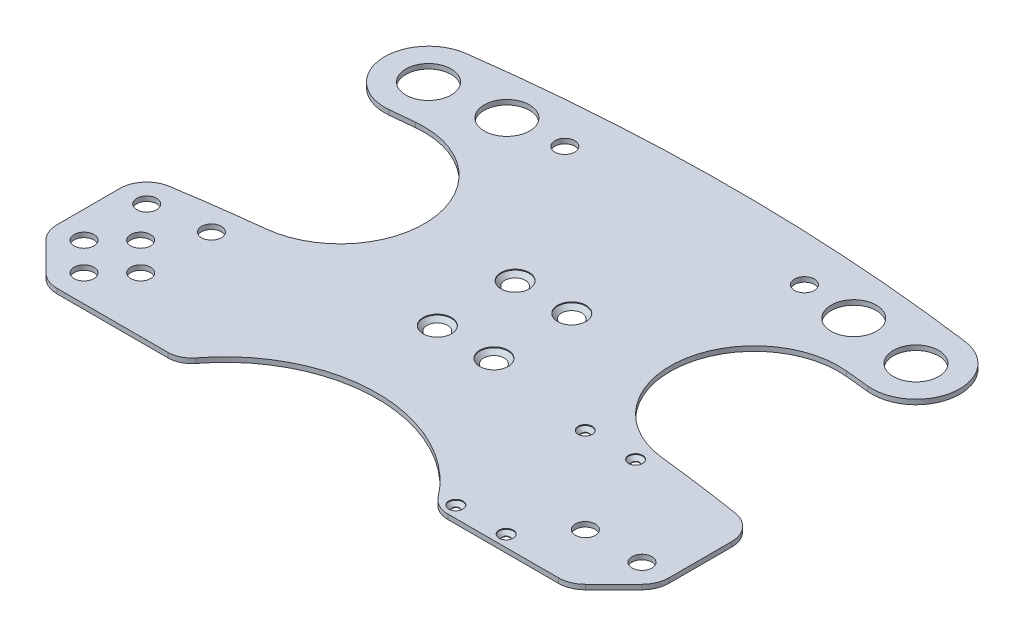
from build123d import *

# Parameters (mm, degrees)
SKETCH1_R                                      = 2.5
BOSS_EXTRUDE1_DEPTH                            = 1.7
CUT_EXTRUDE1_REACH                             = 155.062
SKETCH2_R                                      = 3.5
SKETCH2_R_2                                    = 8
CUT_EXTRUDE2_REACH                             = 155.062
SKETCH3_R                                      = 1.3
CSK_FOR_M5_FLAT_HEAD_MACHINE_SCREW1_AT_2_COUNT = 2
CSK_FOR_M5_FLAT_HEAD_MACHINE_SCREW1_AT_2_PITCH = 20
CSK_FOR_M5_FLAT_HEAD_MACHINE_SCREW1_AT_3_COUNT = 2
CSK_FOR_M5_FLAT_HEAD_MACHINE_SCREW1_AT_3_PITCH = 34.003676272
CSK_FOR_M5_FLAT_HEAD_MACHINE_SCREW1_AT_4_COUNT = 2
CSK_FOR_M5_FLAT_HEAD_MACHINE_SCREW1_AT_4_PITCH = 27.5
CSK_FOR_M2_5_FLAT_HEAD_MACHINE_SCREW1_AT_COUNT = 2
CSK_FOR_M2_5_FLAT_HEAD_MACHINE_SCREW1_AT_PITCH = 17.78
CSK_FOR_M2_5_FLAT_HEAD_MACHINE_SCREW_2_COUNT   = 2
CSK_FOR_M2_5_FLAT_HEAD_MACHINE_SCREW_2_PITCH   = 49.055548106
CSK_FOR_M2_5_FLAT_HEAD_MACHINE_SCREW_3_COUNT   = 2
CSK_FOR_M2_5_FLAT_HEAD_MACHINE_SCREW_3_PITCH   = 45.72
FILLET1_R                                      = 8.5


with BuildPart() as part:
    # Sketch1 → Boss-Extrude1 (new body)
    with BuildSketch(Plane(origin=(0, 0, 0), x_dir=(1, 0, 0), z_dir=(0, 1, 0))):
        with BuildLine():
            Line((-73.314391493, -95), (73.314391493, -95))
            ThreePointArc((73.314391493, -95), (120, 0), (73.314391493, 95))
            Line((73.314391493, 95), (-73.314391493, 95))
            ThreePointArc((-73.314391493, 95), (-120, 0), (-73.314391493, -95))
        make_face()
        with Locations((-10, 13.75)):
            Circle(SKETCH1_R, mode=Mode.SUBTRACT)
        with Locations((-10, -13.75)):
            Circle(SKETCH1_R, mode=Mode.SUBTRACT)
        with Locations((10, -13.75)):
            Circle(SKETCH1_R, mode=Mode.SUBTRACT)
        with Locations((10, 13.75)):
            Circle(SKETCH1_R, mode=Mode.SUBTRACT)
    extrude(amount=BOSS_EXTRUDE1_DEPTH)

    # Sketch2 → Cut-Extrude1 (cut, up to next)
    with BuildSketch(Plane(origin=(0, 1.7, 0), x_dir=(1, 0, 0), z_dir=(0, 1, 0)), mode=Mode.PRIVATE) as cut_extrude1_sk1:
        with Locations((-88.540600769, -40)):
            Circle(SKETCH2_R)
    cut_extrude1_tool1 = extrude(cut_extrude1_sk1.sketch, amount=-CUT_EXTRUDE1_REACH, mode=Mode.PRIVATE) & part.part
    # Sketch2 → Cut-Extrude1 (cut, up to next)
    with BuildSketch(Plane(origin=(0, 1.7, 0), x_dir=(1, 0, 0), z_dir=(0, 1, 0)), mode=Mode.PRIVATE) as cut_extrude1_sk2:
        with Locations((-78.540600769, -50)):
            Circle(SKETCH2_R)
    cut_extrude1_tool2 = extrude(cut_extrude1_sk2.sketch, amount=-CUT_EXTRUDE1_REACH, mode=Mode.PRIVATE) & part.part
    # Sketch2 → Cut-Extrude1 (cut, up to next)
    with BuildSketch(Plane(origin=(0, 1.7, 0), x_dir=(1, 0, 0), z_dir=(0, 1, 0)), mode=Mode.PRIVATE) as cut_extrude1_sk3:
        with Locations((-88.540600769, -60)):
            Circle(SKETCH2_R)
    cut_extrude1_tool3 = extrude(cut_extrude1_sk3.sketch, amount=-CUT_EXTRUDE1_REACH, mode=Mode.PRIVATE) & part.part
    # Sketch2 → Cut-Extrude1 (cut, up to next)
    with BuildSketch(Plane(origin=(0, 1.7, 0), x_dir=(1, 0, 0), z_dir=(0, 1, 0)), mode=Mode.PRIVATE) as cut_extrude1_sk4:
        with Locations((-98.540600769, -50)):
            Circle(SKETCH2_R)
    cut_extrude1_tool4 = extrude(cut_extrude1_sk4.sketch, amount=-CUT_EXTRUDE1_REACH, mode=Mode.PRIVATE) & part.part
    # Sketch2 → Cut-Extrude1 (cut, up to next)
    with BuildSketch(Plane(origin=(0, 1.7, 0), x_dir=(1, 0, 0), z_dir=(0, 1, 0)), mode=Mode.PRIVATE) as cut_extrude1_sk5:
        with Locations((78.540600769, -50)):
            Circle(SKETCH2_R)
    cut_extrude1_tool5 = extrude(cut_extrude1_sk5.sketch, amount=-CUT_EXTRUDE1_REACH, mode=Mode.PRIVATE) & part.part
    # Sketch2 → Cut-Extrude1 (cut, up to next)
    with BuildSketch(Plane(origin=(0, 1.7, 0), x_dir=(1, 0, 0), z_dir=(0, 1, 0)), mode=Mode.PRIVATE) as cut_extrude1_sk6:
        with Locations((98.540600769, -50)):
            Circle(SKETCH2_R)
    cut_extrude1_tool6 = extrude(cut_extrude1_sk6.sketch, amount=-CUT_EXTRUDE1_REACH, mode=Mode.PRIVATE) & part.part
    # Sketch2 → Cut-Extrude1 (cut, up to next)
    with BuildSketch(Plane(origin=(0, 1.7, 0), x_dir=(1, 0, 0), z_dir=(0, 1, 0)), mode=Mode.PRIVATE) as cut_extrude1_sk7:
        with Locations((-98.540600769, -27.862546721)):
            Circle(SKETCH2_R)
    cut_extrude1_tool7 = extrude(cut_extrude1_sk7.sketch, amount=-CUT_EXTRUDE1_REACH, mode=Mode.PRIVATE) & part.part
    # Sketch2 → Cut-Extrude1 (cut, up to next)
    with BuildSketch(Plane(origin=(0, 1.7, 0), x_dir=(1, 0, 0), z_dir=(0, 1, 0)), mode=Mode.PRIVATE) as cut_extrude1_sk8:
        with Locations((-78.540600769, -25)):
            Circle(SKETCH2_R)
    cut_extrude1_tool8 = extrude(cut_extrude1_sk8.sketch, amount=-CUT_EXTRUDE1_REACH, mode=Mode.PRIVATE) & part.part
    # Sketch2 → Cut-Extrude1 (cut, up to next)
    with BuildSketch(Plane(origin=(0, 1.7, 0), x_dir=(1, 0, 0), z_dir=(0, 1, 0)), mode=Mode.PRIVATE) as cut_extrude1_sk9:
        with Locations((-86.094520408, 59.228232759)):
            Circle(SKETCH2_R_2)
    cut_extrude1_tool9 = extrude(cut_extrude1_sk9.sketch, amount=-CUT_EXTRUDE1_REACH, mode=Mode.PRIVATE) & part.part
    # Sketch2 → Cut-Extrude1 (cut, up to next)
    with BuildSketch(Plane(origin=(0, 1.7, 0), x_dir=(1, 0, 0), z_dir=(0, 1, 0)), mode=Mode.PRIVATE) as cut_extrude1_sk10:
        with Locations((-61.259580586, 62.084312054)):
            Circle(SKETCH2_R_2)
    cut_extrude1_tool10 = extrude(cut_extrude1_sk10.sketch, amount=-CUT_EXTRUDE1_REACH, mode=Mode.PRIVATE) & part.part
    # Sketch2 → Cut-Extrude1 (cut, up to next)
    with BuildSketch(Plane(origin=(0, 1.7, 0), x_dir=(1, 0, 0), z_dir=(0, 1, 0)), mode=Mode.PRIVATE) as cut_extrude1_sk11:
        with Locations((61.259580586, 62.084312054)):
            Circle(SKETCH2_R_2)
    cut_extrude1_tool11 = extrude(cut_extrude1_sk11.sketch, amount=-CUT_EXTRUDE1_REACH, mode=Mode.PRIVATE) & part.part
    # Sketch2 → Cut-Extrude1 (cut, up to next)
    with BuildSketch(Plane(origin=(0, 1.7, 0), x_dir=(1, 0, 0), z_dir=(0, 1, 0)), mode=Mode.PRIVATE) as cut_extrude1_sk12:
        with Locations((86.094520408, 59.228232759)):
            Circle(SKETCH2_R_2)
    cut_extrude1_tool12 = extrude(cut_extrude1_sk12.sketch, amount=-CUT_EXTRUDE1_REACH, mode=Mode.PRIVATE) & part.part
    # Sketch2 → Cut-Extrude1 (cut, up to next)
    with BuildSketch(Plane(origin=(0, 1.7, 0), x_dir=(1, 0, 0), z_dir=(0, 1, 0)), mode=Mode.PRIVATE) as cut_extrude1_sk13:
        with Locations((-42.320942156, 63.610082158)):
            Circle(SKETCH2_R)
    cut_extrude1_tool13 = extrude(cut_extrude1_sk13.sketch, amount=-CUT_EXTRUDE1_REACH, mode=Mode.PRIVATE) & part.part
    # Sketch2 → Cut-Extrude1 (cut, up to next)
    with BuildSketch(Plane(origin=(0, 1.7, 0), x_dir=(1, 0, 0), z_dir=(0, 1, 0)), mode=Mode.PRIVATE) as cut_extrude1_sk14:
        with Locations((42.320942156, 63.610082158)):
            Circle(SKETCH2_R)
    cut_extrude1_tool14 = extrude(cut_extrude1_sk14.sketch, amount=-CUT_EXTRUDE1_REACH, mode=Mode.PRIVATE) & part.part
    add(cut_extrude1_tool1.solids().sort_by_distance((-88.540601, 1.7, 40))[0], mode=Mode.SUBTRACT)
    add(cut_extrude1_tool2.solids().sort_by_distance((-78.540601, 1.7, 50))[0], mode=Mode.SUBTRACT)
    add(cut_extrude1_tool3.solids().sort_by_distance((-88.540601, 1.7, 60))[0], mode=Mode.SUBTRACT)
    add(cut_extrude1_tool4.solids().sort_by_distance((-98.540601, 1.7, 50))[0], mode=Mode.SUBTRACT)
    add(cut_extrude1_tool5.solids().sort_by_distance((78.540601, 1.7, 50))[0], mode=Mode.SUBTRACT)
    add(cut_extrude1_tool6.solids().sort_by_distance((98.540601, 1.7, 50))[0], mode=Mode.SUBTRACT)
    add(cut_extrude1_tool7.solids().sort_by_distance((-98.540601, 1.7, 27.862547))[0], mode=Mode.SUBTRACT)
    add(cut_extrude1_tool8.solids().sort_by_distance((-78.540601, 1.7, 25))[0], mode=Mode.SUBTRACT)
    add(cut_extrude1_tool9.solids().sort_by_distance((-86.09452, 1.7, -59.228233))[0], mode=Mode.SUBTRACT)
    add(cut_extrude1_tool10.solids().sort_by_distance((-61.259581, 1.7, -62.084312))[0], mode=Mode.SUBTRACT)
    add(cut_extrude1_tool11.solids().sort_by_distance((61.259581, 1.7, -62.084312))[0], mode=Mode.SUBTRACT)
    add(cut_extrude1_tool12.solids().sort_by_distance((86.09452, 1.7, -59.228233))[0], mode=Mode.SUBTRACT)
    add(cut_extrude1_tool13.solids().sort_by_distance((-42.320942, 1.7, -63.610082))[0], mode=Mode.SUBTRACT)
    add(cut_extrude1_tool14.solids().sort_by_distance((42.320942, 1.7, -63.610082))[0], mode=Mode.SUBTRACT)

    # Sketch3 → Cut-Extrude2 (cut, up to next)
    with BuildSketch(Plane(origin=(0, 1.7, 0), x_dir=(1, 0, 0), z_dir=(0, 1, 0)), mode=Mode.PRIVATE) as cut_extrude2_sk1:
        with BuildLine():
            Line((-76.105925997, 44.650651574), (-84.550645906, 43.805313077))
            ThreePointArc((-84.550645906, 43.805313077), (-99.436668511, 51.3391844), (-98.864520746, 68.013282068))
            ThreePointArc((-98.864520746, 68.013282068), (-119.734623685, 7.97620781), (-107.012417284, -54.298642221))
            ThreePointArc((-107.012417284, -54.298642221), (-107.779979993, -52.209948315), (-108.040600769, -50))
            Line((-108.040600769, -50), (-108.040600769, -27.862546721))
            ThreePointArc((-108.040600769, -27.862546721), (-105.768300058, -21.697292226), (-100.038419088, -18.48136661))
            ThreePointArc((-100.038419088, -18.48136661), (-84.982869082, -16.262381048), (-69.878431955, -14.405108328))
            ThreePointArc((-69.878431955, -14.405108328), (-43.620166463, 18.220082253), (-76.105925997, 44.650651574))
        make_face()
    cut_extrude2_tool1 = extrude(cut_extrude2_sk1.sketch, amount=-CUT_EXTRUDE2_REACH, mode=Mode.PRIVATE) & part.part
    # Sketch3 → Cut-Extrude2 (cut, up to next)
    with BuildSketch(Plane(origin=(0, 1.7, 0), x_dir=(1, 0, 0), z_dir=(0, 1, 0)), mode=Mode.PRIVATE) as cut_extrude2_sk2:
        with BuildLine():
            ThreePointArc((-98.864520746, 68.013282068), (-94.209950954, 72.433905292), (-88.163447862, 74.589532807))
            ThreePointArc((-88.163447862, 74.589532807), (1.3e-08, 80.5), (88.163447888, 74.589532804))
            ThreePointArc((88.163447888, 74.589532804), (94.209951277, 72.433905093), (98.864521161, 68.013281465))
            ThreePointArc((98.864521161, 68.013281465), (87.140491363, 82.50172583), (73.314391493, 95))
            Line((73.314391493, 95), (-73.314391493, 95))
            ThreePointArc((-73.314391493, 95), (-87.140491112, 82.501726096), (-98.864520746, 68.013282068))
        make_face()
    cut_extrude2_tool2 = extrude(cut_extrude2_sk2.sketch, amount=-CUT_EXTRUDE2_REACH, mode=Mode.PRIVATE) & part.part
    # Sketch3 → Cut-Extrude2 (cut, up to next)
    with BuildSketch(Plane(origin=(0, 1.7, 0), x_dir=(1, 0, 0), z_dir=(0, 1, 0)), mode=Mode.PRIVATE) as cut_extrude2_sk3:
        with BuildLine():
            ThreePointArc((-105.258115191, -56.717514421), (-106.230963521, -55.577483371), (-107.012417284, -54.298642221))
            ThreePointArc((-107.012417284, -54.298642221), (-92.431540192, -76.527187181), (-73.314391493, -95))
            Line((-73.314391493, -95), (73.314391493, -95))
            ThreePointArc((73.314391493, -95), (92.431540082, -76.527187314), (107.012417128, -54.298642528))
            ThreePointArc((107.012417128, -54.298642528), (106.23096342, -55.57748351), (105.258115191, -56.717514421))
            Line((105.258115191, -56.717514421), (95.258115191, -66.717514421))
            ThreePointArc((95.258115191, -66.717514421), (92.176093377, -68.776855559), (88.540600769, -69.5))
            Line((88.540600769, -69.5), (45.040600769, -69.5))
            ThreePointArc((45.040600769, -69.5), (0, -45), (-45.040600769, -69.5))
            Line((-45.040600769, -69.5), (-88.540600769, -69.5))
            ThreePointArc((-88.540600769, -69.5), (-92.176093377, -68.776855559), (-95.258115191, -66.717514421))
            Line((-95.258115191, -66.717514421), (-105.258115191, -56.717514421))
        make_face()
    cut_extrude2_tool3 = extrude(cut_extrude2_sk3.sketch, amount=-CUT_EXTRUDE2_REACH, mode=Mode.PRIVATE) & part.part
    # Sketch3 → Cut-Extrude2 (cut, up to next)
    with BuildSketch(Plane(origin=(0, 1.7, 0), x_dir=(1, 0, 0), z_dir=(0, 1, 0)), mode=Mode.PRIVATE) as cut_extrude2_sk4:
        with BuildLine():
            ThreePointArc((69.878431166, -14.405108241), (84.982868127, -16.262380919), (100.038417968, -18.481366431))
            ThreePointArc((100.038417968, -18.481366431), (105.768299691, -21.697291795), (108.040600769, -27.862546721))
            Line((108.040600769, -27.862546721), (108.040600769, -50))
            ThreePointArc((108.040600769, -50), (107.779979953, -52.209948483), (107.012417128, -54.298642528))
            ThreePointArc((107.012417128, -54.298642528), (119.734623721, 7.976207273), (98.864521161, 68.013281465))
            ThreePointArc((98.864521161, 68.013281465), (99.436668324, 51.339184085), (84.550645906, 43.805313077))
            Line((84.550645906, 43.805313077), (76.105925997, 44.650651574))
            ThreePointArc((76.105925997, 44.650651574), (43.620166505, 18.220082647), (69.878431166, -14.405108241))
        make_face()
    cut_extrude2_tool4 = extrude(cut_extrude2_sk4.sketch, amount=-CUT_EXTRUDE2_REACH, mode=Mode.PRIVATE) & part.part
    # Sketch3 → Cut-Extrude2 (cut, up to next)
    with BuildSketch(Plane(origin=(0, 1.7, 0), x_dir=(1, 0, 0), z_dir=(0, 1, 0)), mode=Mode.PRIVATE) as cut_extrude2_sk5:
        with Locations((48.150600769, -19.64)):
            Circle(SKETCH3_R)
    cut_extrude2_tool5 = extrude(cut_extrude2_sk5.sketch, amount=-CUT_EXTRUDE2_REACH, mode=Mode.PRIVATE) & part.part
    # Sketch3 → Cut-Extrude2 (cut, up to next)
    with BuildSketch(Plane(origin=(0, 1.7, 0), x_dir=(1, 0, 0), z_dir=(0, 1, 0)), mode=Mode.PRIVATE) as cut_extrude2_sk6:
        with Locations((65.930600769, -19.64)):
            Circle(SKETCH3_R)
    cut_extrude2_tool6 = extrude(cut_extrude2_sk6.sketch, amount=-CUT_EXTRUDE2_REACH, mode=Mode.PRIVATE) & part.part
    # Sketch3 → Cut-Extrude2 (cut, up to next)
    with BuildSketch(Plane(origin=(0, 1.7, 0), x_dir=(1, 0, 0), z_dir=(0, 1, 0)), mode=Mode.PRIVATE) as cut_extrude2_sk7:
        with Locations((65.930600769, -65.36)):
            Circle(SKETCH3_R)
    cut_extrude2_tool7 = extrude(cut_extrude2_sk7.sketch, amount=-CUT_EXTRUDE2_REACH, mode=Mode.PRIVATE) & part.part
    # Sketch3 → Cut-Extrude2 (cut, up to next)
    with BuildSketch(Plane(origin=(0, 1.7, 0), x_dir=(1, 0, 0), z_dir=(0, 1, 0)), mode=Mode.PRIVATE) as cut_extrude2_sk8:
        with Locations((48.150600769, -65.36)):
            Circle(SKETCH3_R)
    cut_extrude2_tool8 = extrude(cut_extrude2_sk8.sketch, amount=-CUT_EXTRUDE2_REACH, mode=Mode.PRIVATE) & part.part
    add(cut_extrude2_tool1.solids().sort_by_distance((-86.043963, 1.7, -12.513289))[0], mode=Mode.SUBTRACT)
    add(cut_extrude2_tool2.solids().sort_by_distance((0, 1.7, -86.177495))[0], mode=Mode.SUBTRACT)
    add(cut_extrude2_tool3.solids().sort_by_distance((0, 1.7, 75.736765))[0], mode=Mode.SUBTRACT)
    add(cut_extrude2_tool4.solids().sort_by_distance((86.043963, 1.7, -12.513289))[0], mode=Mode.SUBTRACT)
    add(cut_extrude2_tool5.solids().sort_by_distance((48.150601, 1.7, 19.64))[0], mode=Mode.SUBTRACT)
    add(cut_extrude2_tool6.solids().sort_by_distance((65.930601, 1.7, 19.64))[0], mode=Mode.SUBTRACT)
    add(cut_extrude2_tool7.solids().sort_by_distance((65.930601, 1.7, 65.36))[0], mode=Mode.SUBTRACT)
    add(cut_extrude2_tool8.solids().sort_by_distance((48.150601, 1.7, 65.36))[0], mode=Mode.SUBTRACT)

    # Sketch5 → CSK for M5 Flat Head Machine Screw1 (revolve, cut)
    with BuildSketch(Plane(origin=(-10, 1.7, -13.75), x_dir=(0, 0, 1), z_dir=(1, 0, 0))):
        Polygon((0, 0), (0, 6.502151548), (2.5, 5), (2.5, 2.8), (5, 0.3), (5, 0), align=None)
    csk_for_m5_flat_head_machine_screw1 = revolve(axis=Axis((-10, 8.05, -13.75), (0, -1, 0)), mode=Mode.SUBTRACT)

    # CSK for M5 Flat Head Machine Screw1 at 2: CSK for M5 Flat Head Machine Screw1 ×2
    with Locations(*[(i * CSK_FOR_M5_FLAT_HEAD_MACHINE_SCREW1_AT_2_PITCH, 0, 0) for i in range(1, CSK_FOR_M5_FLAT_HEAD_MACHINE_SCREW1_AT_2_COUNT)]):
        add(csk_for_m5_flat_head_machine_screw1, mode=Mode.SUBTRACT)

    # CSK for M5 Flat Head Machine Screw1 at 3: CSK for M5 Flat Head Machine Screw1 ×2
    with Locations(*[Vector(0.5881716976750462, 0, 0.8087360843031886) * (i * CSK_FOR_M5_FLAT_HEAD_MACHINE_SCREW1_AT_3_PITCH) for i in range(1, CSK_FOR_M5_FLAT_HEAD_MACHINE_SCREW1_AT_3_COUNT)]):
        add(csk_for_m5_flat_head_machine_screw1, mode=Mode.SUBTRACT)

    # CSK for M5 Flat Head Machine Screw1 at 4: CSK for M5 Flat Head Machine Screw1 ×2
    with Locations(*[(0, 0, i * CSK_FOR_M5_FLAT_HEAD_MACHINE_SCREW1_AT_4_PITCH) for i in range(1, CSK_FOR_M5_FLAT_HEAD_MACHINE_SCREW1_AT_4_COUNT)]):
        add(csk_for_m5_flat_head_machine_screw1, mode=Mode.SUBTRACT)

    # Sketch7 → CSK for M2.5 Flat Head Machine Screw1 (revolve, cut)
    with BuildSketch(Plane(origin=(48.150600769, 1.7, 19.64), x_dir=(0, 0, 1), z_dir=(1, 0, 0))):
        Polygon((0, 0), (0, 5.751075774), (1.25, 5), (1.25, 1.55), (2.5, 0.3), (2.5, 0), align=None)
    csk_for_m2_5_flat_head_machine_screw1 = revolve(axis=Axis((48.150600769, 8.05, 19.64), (0, -1, 0)), mode=Mode.SUBTRACT)

    # CSK for M2.5 Flat Head Machine Screw1 at: CSK for M2.5 Flat Head Machine Screw1 ×2
    with Locations(*[(i * CSK_FOR_M2_5_FLAT_HEAD_MACHINE_SCREW1_AT_PITCH, 0, 0) for i in range(1, CSK_FOR_M2_5_FLAT_HEAD_MACHINE_SCREW1_AT_COUNT)]):
        add(csk_for_m2_5_flat_head_machine_screw1, mode=Mode.SUBTRACT)

    # CSK for M2.5 Flat Head Machine Screw 2: CSK for M2.5 Flat Head Machine Screw1 ×2
    with Locations(*[Vector(0.3624462611549487, 0, 0.9320046715412958) * (i * CSK_FOR_M2_5_FLAT_HEAD_MACHINE_SCREW_2_PITCH) for i in range(1, CSK_FOR_M2_5_FLAT_HEAD_MACHINE_SCREW_2_COUNT)]):
        add(csk_for_m2_5_flat_head_machine_screw1, mode=Mode.SUBTRACT)

    # CSK for M2.5 Flat Head Machine Screw 3: CSK for M2.5 Flat Head Machine Screw1 ×2
    with Locations(*[(0, 0, i * CSK_FOR_M2_5_FLAT_HEAD_MACHINE_SCREW_3_PITCH) for i in range(1, CSK_FOR_M2_5_FLAT_HEAD_MACHINE_SCREW_3_COUNT)]):
        add(csk_for_m2_5_flat_head_machine_screw1, mode=Mode.SUBTRACT)

    # Fillet1
    fillet1_edges = [part.edges().sort_by_distance(p)[0] for p in [
        (45.040600769, 0.85, 69.5),
        (-45.040600769, 0.85, 69.5),
    ]]
    fillet(fillet1_edges, radius=FILLET1_R)


solid = part.part
